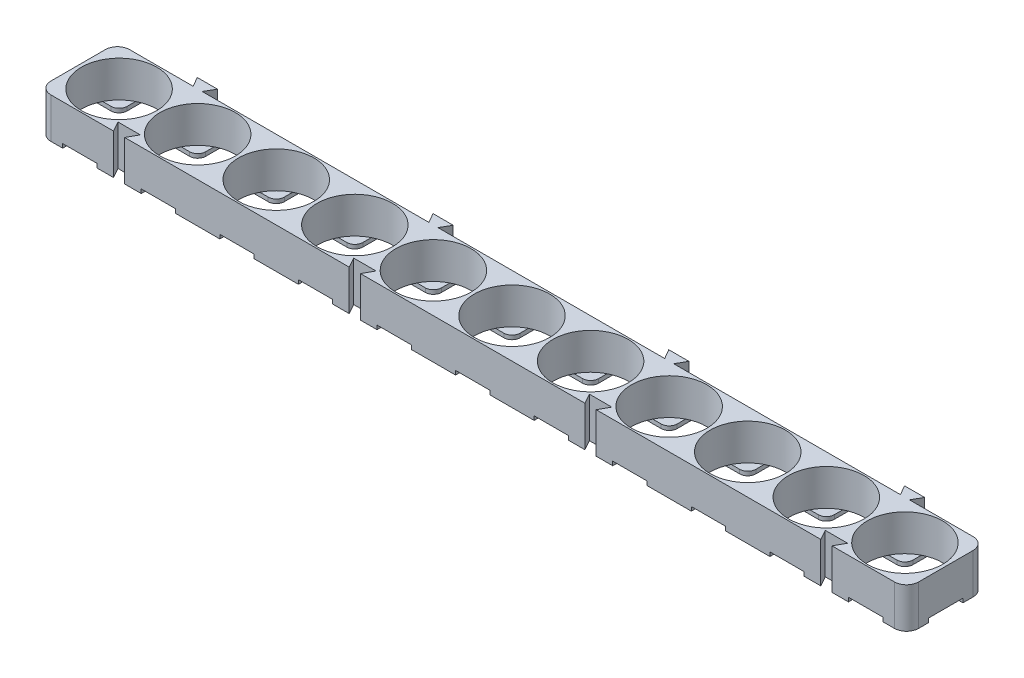
from build123d import *

# Parameters (mm, degrees)
SKETCH3_R           = 9.35
BOSS_EXTRUDE3_DEPTH = 10
SKETCH3_4_R         = 9.35
BOSS_EXTRUDE6_DEPTH = 1
SKETCH8_W           = 215.3
SKETCH8_H           = 8.5
SKETCH8_W_2         = 8.5
SKETCH8_H_2         = 19.5
CUT_EXTRUDE4_DEPTH  = 206.706453472
FILLET3_R           = 2
FILLET4_R           = 3


with BuildPart() as part:
    # Sketch3 → Boss-Extrude3 (new body)
    with BuildSketch(Plane(origin=(0, 0, 0), x_dir=(1, 0, 0), z_dir=(0, 1, 0))):
        Polygon((8.635640646, 9.75), (-10.15, 9.75), (-10.15, -9.75), (8.360772629, -9.75), (6.975, -7.25), (12.525, -7.25), (11.139227371, -9.75), (66.860772629, -9.75), (65.475, -7.25), (71.025, -7.25), (69.639227371, -9.75), (125.360772629, -9.75), (123.975, -7.25), (129.525, -7.25), (128.139227371, -9.75), (183.860772629, -9.75), (182.475, -7.25), (188.025, -7.25), (186.639227371, -9.75), (205.15, -9.75), (205.15, 9.75), (186.364359354, 9.75), (187.75, 12.15), (182.75, 12.15), (184.135640646, 9.75), (127.864359354, 9.75), (129.25, 12.15), (124.25, 12.15), (125.635640646, 9.75), (69.364359354, 9.75), (70.75, 12.15), (65.75, 12.15), (67.135640646, 9.75), (10.864359354, 9.75), (12.25, 12.15), (7.25, 12.15), align=None)
        Circle(SKETCH3_R, mode=Mode.SUBTRACT)
        with Locations((19.5, 0)):
            Circle(SKETCH3_R, mode=Mode.SUBTRACT)
        with Locations((39, 0)):
            Circle(SKETCH3_R, mode=Mode.SUBTRACT)
        with Locations((58.5, 0)):
            Circle(SKETCH3_R, mode=Mode.SUBTRACT)
        with Locations((78, 0)):
            Circle(SKETCH3_R, mode=Mode.SUBTRACT)
        with Locations((97.5, 0)):
            Circle(SKETCH3_R, mode=Mode.SUBTRACT)
        with Locations((117, 0)):
            Circle(SKETCH3_R, mode=Mode.SUBTRACT)
        with Locations((136.5, 0)):
            Circle(SKETCH3_R, mode=Mode.SUBTRACT)
        with Locations((156, 0)):
            Circle(SKETCH3_R, mode=Mode.SUBTRACT)
        with Locations((175.5, 0)):
            Circle(SKETCH3_R, mode=Mode.SUBTRACT)
        with Locations((195, 0)):
            Circle(SKETCH3_R, mode=Mode.SUBTRACT)
    extrude(amount=BOSS_EXTRUDE3_DEPTH)

    # Sketch3<4> → Boss-Extrude6 (add)
    with BuildSketch(Plane(origin=(0, 0, 0), x_dir=(1, 0, 0), z_dir=(0, 1, 0))):
        Circle(SKETCH3_4_R)
        with Locations((19.5, 0)):
            Circle(SKETCH3_4_R)
        with Locations((39, 0)):
            Circle(SKETCH3_4_R)
        with Locations((58.5, 0)):
            Circle(SKETCH3_4_R)
        with Locations((78, 0)):
            Circle(SKETCH3_4_R)
        with Locations((97.5, 0)):
            Circle(SKETCH3_4_R)
        with Locations((117, 0)):
            Circle(SKETCH3_4_R)
        with Locations((136.5, 0)):
            Circle(SKETCH3_4_R)
        with Locations((156, 0)):
            Circle(SKETCH3_4_R)
        with Locations((175.5, 0)):
            Circle(SKETCH3_4_R)
        with Locations((195, 0)):
            Circle(SKETCH3_4_R)
    extrude(amount=BOSS_EXTRUDE6_DEPTH)

    # Sketch8 → Cut-Extrude4 (cut, through all)
    with BuildSketch(Plane(origin=(0, 1, 0), x_dir=(1, 0, 0), z_dir=(0, 1, 0))):
        with Locations((97.5, 0)):
            Rectangle(SKETCH8_W, SKETCH8_H)
        Rectangle(SKETCH8_W_2, SKETCH8_H_2)
        with Locations((19.5, 0)):
            Rectangle(SKETCH8_W_2, SKETCH8_H_2)
        with Locations((39, 0)):
            Rectangle(SKETCH8_W_2, SKETCH8_H_2)
        with Locations((58.5, 0)):
            Rectangle(SKETCH8_W_2, SKETCH8_H_2)
        with Locations((78, 0)):
            Rectangle(SKETCH8_W_2, SKETCH8_H_2)
        with Locations((97.5, 0)):
            Rectangle(SKETCH8_W_2, SKETCH8_H_2)
        with Locations((117, 0)):
            Rectangle(SKETCH8_W_2, SKETCH8_H_2)
        with Locations((136.5, 0)):
            Rectangle(SKETCH8_W_2, SKETCH8_H_2)
        with Locations((156, 0)):
            Rectangle(SKETCH8_W_2, SKETCH8_H_2)
        with Locations((175.5, 0)):
            Rectangle(SKETCH8_W_2, SKETCH8_H_2)
        with Locations((195, 0)):
            Rectangle(SKETCH8_W_2, SKETCH8_H_2)
    extrude(amount=-CUT_EXTRUDE4_DEPTH, mode=Mode.SUBTRACT)

    # Fillet3
    fillet3_edges = [part.edges().sort_by_distance(p)[0] for p in [
        (4.25, 0.5, -4.25),
        (-4.25, 0.5, -4.25),
        (4.25, 0.5, 4.25),
        (-4.25, 0.5, 4.25),
        (190.75, 0.5, -4.25),
        (190.75, 0.5, 4.25),
        (171.25, 0.5, -4.25),
        (171.25, 0.5, 4.25),
        (151.75, 0.5, 4.25),
        (151.75, 0.5, -4.25),
        (132.25, 0.5, -4.25),
        (132.25, 0.5, 4.25),
        (112.75, 0.5, -4.25),
        (93.25, 0.5, 4.25),
        (93.25, 0.5, -4.25),
        (73.75, 0.5, 4.25),
        (73.75, 0.5, -4.25),
        (54.25, 0.5, -4.25),
        (54.25, 0.5, 4.25),
        (34.75, 0.5, 4.25),
        (62.75, 0.5, -4.25),
        (62.75, 0.5, 4.25),
        (82.25, 0.5, -4.25),
        (82.25, 0.5, 4.25),
        (101.75, 0.5, -4.25),
        (101.75, 0.5, 4.25),
        (121.25, 0.5, -4.25),
        (121.25, 0.5, 4.25),
        (140.75, 0.5, 4.25),
        (140.75, 0.5, -4.25),
        (160.25, 0.5, -4.25),
        (160.25, 0.5, 4.25),
        (179.75, 0.5, 4.25),
        (179.75, 0.5, -4.25),
        (199.25, 0.5, -4.25),
        (199.25, 0.5, 4.25),
        (43.25, 0.5, 4.25),
        (43.25, 0.5, -4.25),
        (23.75, 0.5, -4.25),
        (23.75, 0.5, 4.25),
        (15.25, 0.5, 4.25),
        (15.25, 0.5, -4.25),
        (34.75, 0.5, -4.25),
        (112.75, 0.5, 4.25),
    ]]
    fillet(fillet3_edges, radius=FILLET3_R)

    # Fillet4
    fillet4_edges = [part.edges().sort_by_distance(p)[0] for p in [
        (205.15, 5, 9.75),
        (205.15, 5, -9.75),
        (-10.15, 5, 9.75),
        (-10.15, 5, -9.75),
    ]]
    fillet(fillet4_edges, radius=FILLET4_R)


solid = part.part
